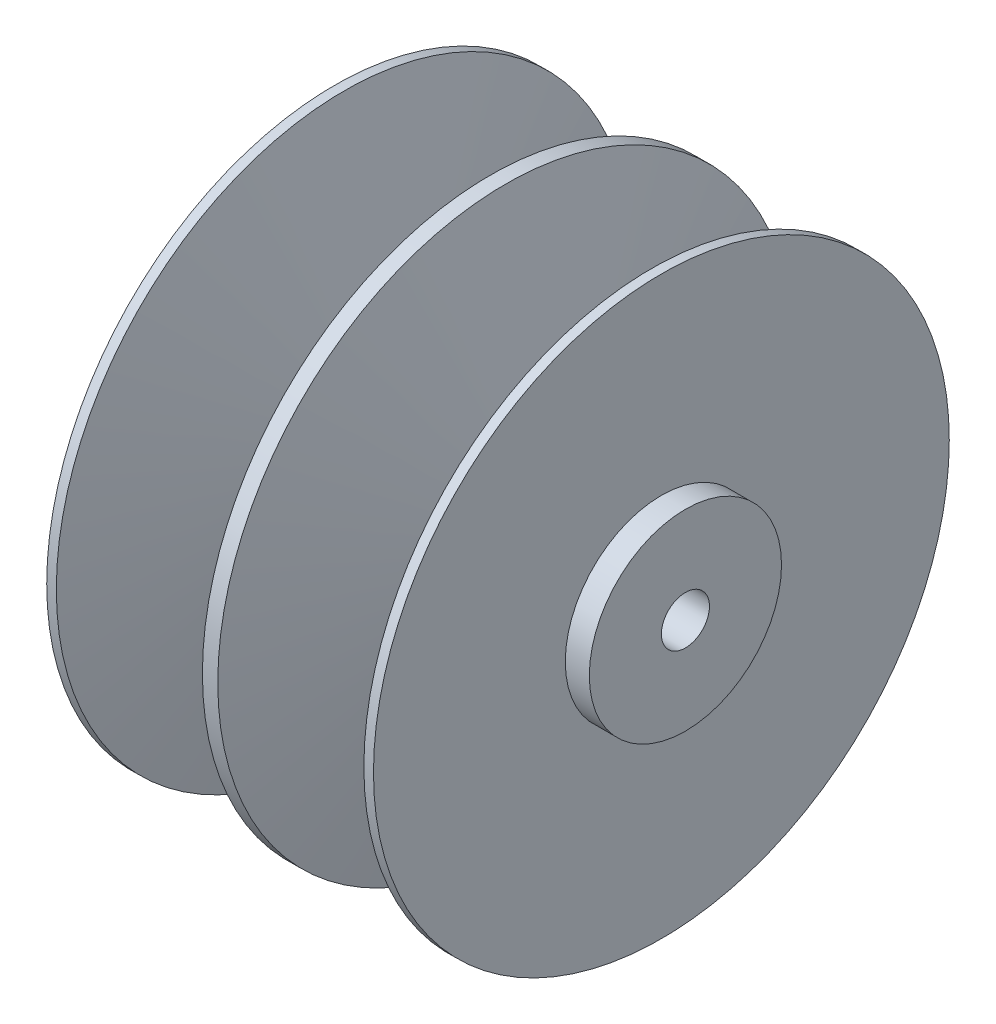
from build123d import *


with BuildPart() as part:
    # Sketch1 → Revolve1 (revolve)
    with BuildSketch(Plane.XY):
        Polygon((28.317833724, 6.35), (49.53, 6.35), (49.53, 25.4), (43.18, 25.4), (43.18, 76.09205), (40.64, 76.09205), (28.317833724, 12.7), align=None)
        Polygon((14.354166276, 12.7), (2.032, 76.09205), (-2.032, 76.09205), (-14.354166276, 12.7), (-14.354166276, 6.35), (14.354166276, 6.35), align=None)
        Polygon((-28.317833724, 6.35), (-28.317833724, 12.7), (-40.64, 76.09205), (-43.18, 76.09205), (-43.18, 25.4), (-49.53, 25.4), (-49.53, 6.35), align=None)
    revolve(axis=Axis((0, 0, 0), (-1, 0, 0)))


solid = part.part
